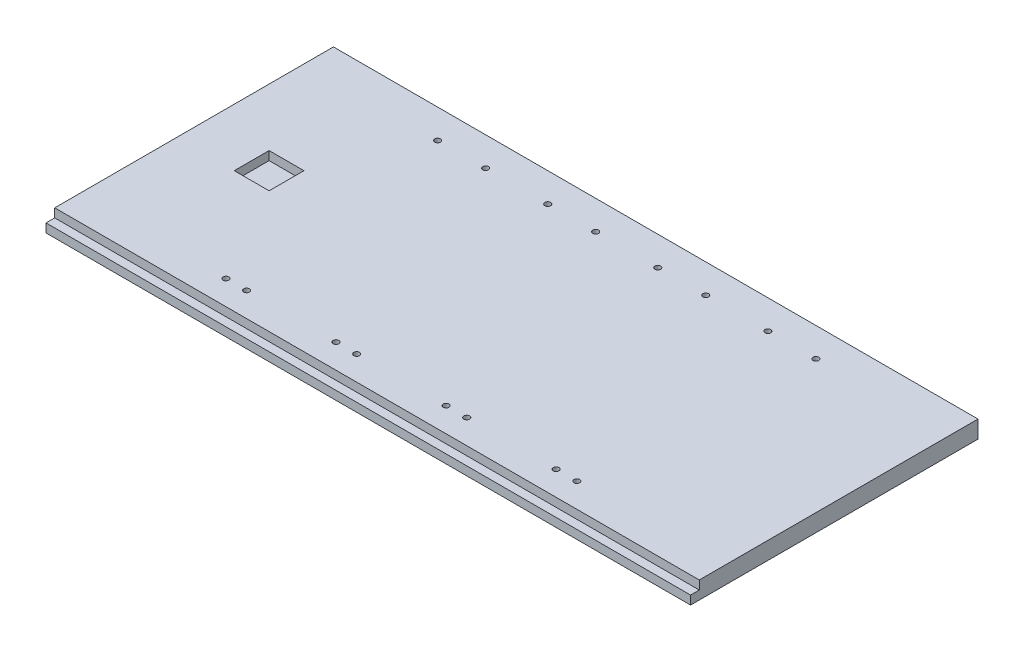
from build123d import *

# Parameters (mm, degrees)
SKETCH3_W           = 469.9
SKETCH3_H           = 209.55
BOSS_EXTRUDE1_DEPTH = 12.7
SKETCH4_R           = 2.1
CUT_EXTRUDE3_DEPTH  = 258.566677047
SKETCH5_R           = 2.1
CUT_EXTRUDE4_DEPTH  = 258.566677047
SKETCH7_W           = 25.4
SKETCH7_H           = 25.4
CUT_EXTRUDE5_DEPTH  = 6.35
CUT_EXTRUDE6_REACH  = 483.607
SKETCH8_W           = 6.35
SKETCH8_H           = 6.35


with BuildPart() as part:
    # Sketch3 → Boss-Extrude1 (new body)
    with BuildSketch(Plane(origin=(0, 0, 0), x_dir=(1, 0, 0), z_dir=(0, 1, 0))):
        Rectangle(SKETCH3_W, SKETCH3_H)
    extrude(amount=BOSS_EXTRUDE1_DEPTH)

    # Sketch4 → Cut-Extrude3 (cut, through all)
    with BuildSketch(Plane(origin=(0, 12.7, 0), x_dir=(1, 0, 0), z_dir=(0, 1, 0))):
        with Locations((-102.9, 83.65)):
            Circle(SKETCH4_R)
        with Locations((-22.65, 83.65)):
            Circle(SKETCH4_R)
        with Locations((57.6, 83.65)):
            Circle(SKETCH4_R)
        with Locations((137.85, 83.65)):
            Circle(SKETCH4_R)
        with Locations((112.85, -80.65)):
            Circle(SKETCH4_R)
        with Locations((32.6, -80.65)):
            Circle(SKETCH4_R)
        with Locations((-47.65, -80.65)):
            Circle(SKETCH4_R)
        with Locations((-127.9, -80.65)):
            Circle(SKETCH4_R)
    extrude(amount=-CUT_EXTRUDE3_DEPTH, mode=Mode.SUBTRACT)

    # Sketch5 → Cut-Extrude4 (cut, through all)
    with BuildSketch(Plane(origin=(0, 12.7, 0), x_dir=(1, 0, 0), z_dir=(0, 1, 0))):
        with Locations((-137.85, 83.65)):
            Circle(SKETCH5_R)
        with Locations((-57.6, 83.65)):
            Circle(SKETCH5_R)
        with Locations((22.65, 83.65)):
            Circle(SKETCH5_R)
        with Locations((102.9, 83.65)):
            Circle(SKETCH5_R)
        with Locations((-112.85, -80.65)):
            Circle(SKETCH5_R)
        with Locations((-32.6, -80.65)):
            Circle(SKETCH5_R)
        with Locations((47.65, -80.65)):
            Circle(SKETCH5_R)
        with Locations((127.9, -80.65)):
            Circle(SKETCH5_R)
    extrude(amount=-CUT_EXTRUDE4_DEPTH, mode=Mode.SUBTRACT)

    # Sketch7 → Cut-Extrude5 (cut)
    with BuildSketch(Plane(origin=(0, 12.7, 0), x_dir=(1, 0, 0), z_dir=(0, 1, 0))):
        with Locations((-180.25, 3.175)):
            Rectangle(SKETCH7_W, SKETCH7_H)
    extrude(amount=-CUT_EXTRUDE5_DEPTH, mode=Mode.SUBTRACT)

    # Sketch8 → Cut-Extrude6 (cut, up to next)
    with BuildSketch(Plane.ZY.offset(234.95), mode=Mode.PRIVATE) as cut_extrude6_sk1:
        with Locations((101.6, 9.525)):
            Rectangle(SKETCH8_W, SKETCH8_H)
    cut_extrude6_tool1 = extrude(cut_extrude6_sk1.sketch, amount=-CUT_EXTRUDE6_REACH, mode=Mode.PRIVATE) & part.part
    add(cut_extrude6_tool1.solids().sort_by_distance((-234.95, 9.525, 101.6))[0], mode=Mode.SUBTRACT)


solid = part.part
